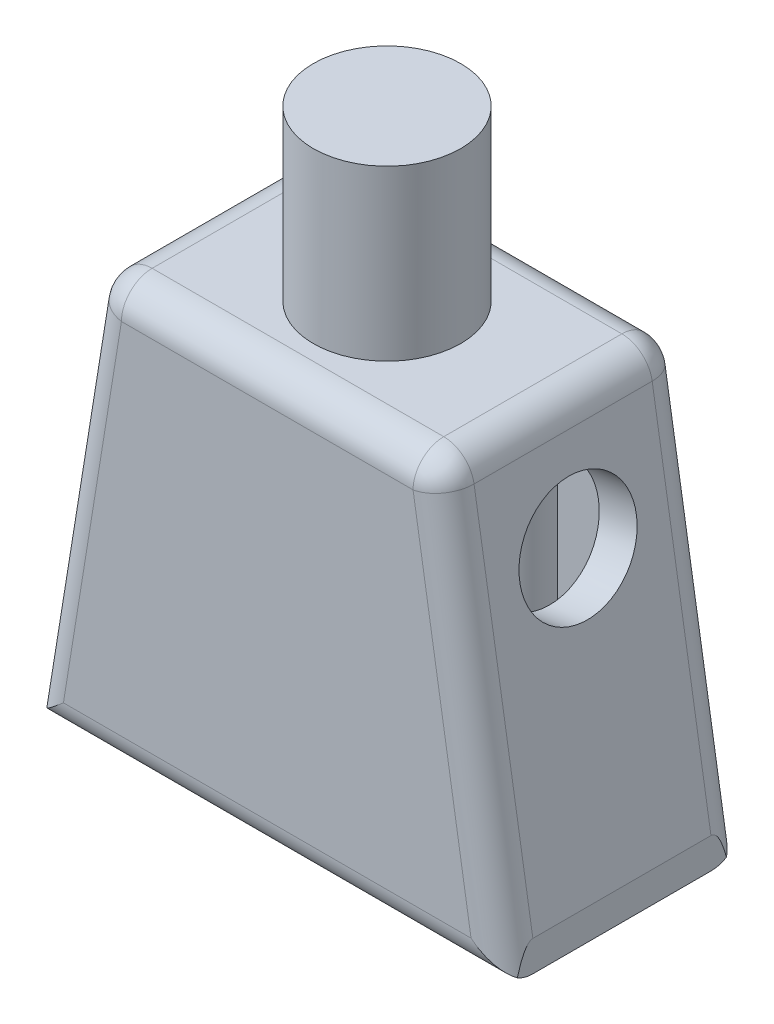
from build123d import *

# Parameters (mm, degrees)
BOSS_EXTRUDE1_DEPTH  = 3.9
SHELL2_T             = -1.25
SKETCH5_R            = 1.9
CUT_EXTRUDE2_DEPTH   = 7.8
FILLET1_R            = 1
SKETCH6_R            = 2.4
BOSS_EXTRUDE2_DEPTH  = 5.5
SKETCH7_R            = 1.25
CUT_EXTRUDE3_DEPTH   = 4.25
BOSS_EXTRUDE3_DEPTH  = 12.449209595
MIRROR3_COPY_1_DEPTH = 12.449209595


with BuildPart() as part:
    # Sketch4 → Boss-Extrude1 (new, symmetric)
    with BuildSketch(Plane.XY):
        Polygon((7.65, 0), (-7.65, 0), (-7.65, 1), (-5.6, 13.699209595), (5.6, 13.699209595), (7.65, 1), align=None)
    extrude(amount=BOSS_EXTRUDE1_DEPTH, both=True)

    # Shell2
    shell2_openings = [part.faces().sort_by_distance(p)[0] for p in [
        (0, 0, 0),
    ]]
    offset(amount=SHELL2_T, openings=shell2_openings, kind=Kind.INTERSECTION)

    # Sketch5 → Cut-Extrude2 (cut)
    with BuildSketch(Plane(origin=(7.613040698, 1.228953134, 0), x_dir=(0, 0, -1), z_dir=(0.9872198433487761, 0.15936430245954739, 0))):
        with Locations(Location((0, 8.728225826, 0), (0, 0, 90))):
            Circle(SKETCH5_R)
    cut_extrude2 = extrude(amount=-CUT_EXTRUDE2_DEPTH, mode=Mode.SUBTRACT)

    # Mirror1: Cut-Extrude2 across plane
    add(cut_extrude2.mirror(Plane(origin=(0, 0, 0), x_dir=(0, 0, 1), z_dir=(1, 0, 0))), mode=Mode.SUBTRACT)

    # Fillet1
    # the kernel refuses this fillet: 1 mm, written as the material it takes off along each edge
    with BuildSketch(Plane(origin=(4.748481766, 12.699209595, -2.9), x_dir=(0, 1, 0), z_dir=(0, 0, -1))) as fillet1_piece_1_section:
        Polygon((0, 0), (FILLET1_R, 0), (FILLET1_R, FILLET1_R * 0.851518233962), (FILLET1_R * 0.15936430246, FILLET1_R * 0.987219843349), align=None)
    fillet1_piece_1 = extrude(amount=FILLET1_R, mode=Mode.PRIVATE)
    fillet1_piece_1 = fillet1_piece_1 - Plane(origin=(4.748481766, 12.699209595, -2.9), x_dir=(-0.6483192491128319, -0.7613686040478513, 0), z_dir=(0, 0, -1)) * Sphere(FILLET1_R, mode=Mode.PRIVATE)
    add(fillet1_piece_1, mode=Mode.SUBTRACT)
    with BuildSketch(Plane(origin=(4.748481766, 12.699209595, 2.9), x_dir=(0, 1, 0), z_dir=(0, 0, 1))) as fillet1_piece_2_section:
        Polygon((0, 0), (FILLET1_R, 0), (FILLET1_R, -FILLET1_R * 0.851518233962), (FILLET1_R * 0.15936430246, -FILLET1_R * 0.987219843349), align=None)
    fillet1_piece_2 = extrude(amount=FILLET1_R, mode=Mode.PRIVATE)
    fillet1_piece_2 = fillet1_piece_2 - Plane(origin=(4.748481766, 12.699209595, 2.9), x_dir=(-0.6483192491128319, -0.7613686040478513, 0), z_dir=(0, 0, 1)) * Sphere(FILLET1_R, mode=Mode.PRIVATE)
    add(fillet1_piece_2, mode=Mode.SUBTRACT)
    with BuildSketch(Plane(origin=(-4.748481766, 12.699209595, 2.9), x_dir=(-0.9872198433487762, 0.15936430245954666, 0), z_dir=(0, 0, 1))) as fillet1_piece_3_section:
        Polygon((0, 0), (FILLET1_R, 0), (FILLET1_R, -FILLET1_R * 0.851518233962), (FILLET1_R * 0.15936430246, -FILLET1_R * 0.987219843349), align=None)
    fillet1_piece_3 = extrude(amount=FILLET1_R, mode=Mode.PRIVATE)
    fillet1_piece_3 = fillet1_piece_3 - Plane(origin=(-4.748481766, 12.699209595, 2.9), x_dir=(0.6483192491128325, -0.7613686040478509, 0), z_dir=(0, 0, 1)) * Sphere(FILLET1_R, mode=Mode.PRIVATE)
    add(fillet1_piece_3, mode=Mode.SUBTRACT)
    with BuildSketch(Plane(origin=(-4.748481766, 12.699209595, -2.9), x_dir=(-0.9872198433487762, 0.15936430245954666, 0), z_dir=(0, 0, -1))) as fillet1_piece_4_section:
        Polygon((0, 0), (FILLET1_R, 0), (FILLET1_R, FILLET1_R * 0.851518233962), (FILLET1_R * 0.15936430246, FILLET1_R * 0.987219843349), align=None)
    fillet1_piece_4 = extrude(amount=FILLET1_R, mode=Mode.PRIVATE)
    fillet1_piece_4 = fillet1_piece_4 - Plane(origin=(-4.748481766, 12.699209595, -2.9), x_dir=(0.6483192491128325, -0.7613686040478509, 0), z_dir=(0, 0, -1)) * Sphere(FILLET1_R, mode=Mode.PRIVATE)
    add(fillet1_piece_4, mode=Mode.SUBTRACT)
    with BuildSketch(Plane(origin=(5.6, 13.699209595, -2.9), x_dir=(-1, 0, 0), z_dir=(0, 0, 1))) as fillet1_piece_5:
        with BuildLine():
            CenterArc((FILLET1_R * 0.851518233962, FILLET1_R), FILLET1_R, 189.17, 80.83)
            Line((-FILLET1_R * 0.135701609387, FILLET1_R * 0.84063569754), (0, 0))
            Line((0, 0), (FILLET1_R * 0.851518233962, 0))
        make_face()
    extrude(amount=5.8, mode=Mode.SUBTRACT)
    with BuildSketch(Plane(origin=(-4.748481766, 13.699209595, 3.9), x_dir=(0, -1, 0), z_dir=(1, 0, 0)), Plane(origin=(-4.748481766, 13.699209595, -3.9), x_dir=(0, 0, 1), z_dir=(1, 0, 0))) as fillet1_piece_6:
        with BuildLine():
            CenterArc((FILLET1_R, FILLET1_R), FILLET1_R, 180, 90)
            Line((0, FILLET1_R), (0, 0))
            Line((0, 0), (FILLET1_R, 0))
        make_face()
    extrude(amount=9.496963532, mode=Mode.SUBTRACT)
    with BuildSketch(Plane(origin=(-5.6, 13.699209595, 2.9), x_dir=(-0.15936430245954636, -0.9872198433487762, 0), z_dir=(0, 0, -1))) as fillet1_piece_7:
        with BuildLine():
            CenterArc((FILLET1_R * 0.851518233962, -FILLET1_R), FILLET1_R, 90, 80.83)
            Line((-FILLET1_R * 0.135701609387, -FILLET1_R * 0.84063569754), (0, 0))
            Line((0, 0), (FILLET1_R * 0.851518233962, 0))
        make_face()
    extrude(amount=5.8, mode=Mode.SUBTRACT)
    with BuildSketch(Plane(origin=(5.735701609, 12.858573897, 3.9), x_dir=(-0.9872198433487762, -0.15936430245954736, 0), z_dir=(0.15936430245954736, -0.9872198433487761, 0)), Plane(origin=(5.735701609, 12.858573897, -3.9), x_dir=(0, 0, 1), z_dir=(0.15936430245954736, -0.9872198433487761, 0)), Plane(origin=(-8.048410756, -1.468049608, -3.9), x_dir=(0, 0, 1), z_dir=(0.15936430245954666, 0.9872198433487762, 0)), Plane(origin=(-8.048410756, -1.468049608, 3.9), x_dir=(0.9872198433487762, -0.15936430245954664, 0), z_dir=(0.15936430245954666, 0.9872198433487762, 0))) as fillet1_piece_8:
        with BuildLine():
            CenterArc((FILLET1_R, FILLET1_R), FILLET1_R, 180, 90)
            Line((0, FILLET1_R), (0, 0))
            Line((0, 0), (FILLET1_R, 0))
        make_face()
    extrude(amount=14.512090293, mode=Mode.SUBTRACT)
    with BuildSketch(Plane(origin=(10.15, 0, 3.9), x_dir=(0, 1, 0), z_dir=(-1, 0, 0)), Plane(origin=(10.15, 0, -3.9), x_dir=(0, 0, 1), z_dir=(-1, 0, 0))) as fillet1_piece_9:
        with BuildLine():
            CenterArc((FILLET1_R, FILLET1_R), FILLET1_R, 180, 90)
            Line((0, FILLET1_R), (0, 0))
            Line((0, 0), (FILLET1_R, 0))
        make_face()
    extrude(amount=20.3, mode=Mode.SUBTRACT)

    # Sketch6 → Boss-Extrude2 (add)
    with BuildSketch(Plane(origin=(0, 13.699209595, 0), x_dir=(1, 0, 0), z_dir=(0, 1, 0))):
        Circle(SKETCH6_R)
    extrude(amount=BOSS_EXTRUDE2_DEPTH)

    # Sketch7 → Cut-Extrude3 (cut)
    with BuildSketch(Plane.XZ.offset(-12.449209595)):
        Circle(SKETCH7_R)
    extrude(amount=-CUT_EXTRUDE3_DEPTH, mode=Mode.SUBTRACT)

    # Sketch8 → Boss-Extrude3 (add)
    with BuildSketch(Plane.XZ):
        with BuildLine():
            Line((-1.5, -2.65), (-1.5, -1.25))
            ThreePointArc((-1.5, -1.25), (-2.489949494, -1.660050506), (-2.9, -2.65))
            Line((-2.9, -2.65), (-1.5, -2.65))
        make_face()
    boss_extrude3 = extrude(amount=-BOSS_EXTRUDE3_DEPTH)

    # Mirror2: Boss-Extrude3 across plane
    add(boss_extrude3.mirror(Plane(origin=(0, 0, 0), x_dir=(0, 0, 1), z_dir=(1, 0, 0))))

    # Mirror3: Boss-Extrude3 across plane
    add(boss_extrude3.mirror(Plane.XY))

    # Mirror3 copy 1 sketch → Mirror3 copy 1 (add)
    with BuildSketch(Plane(origin=(0, 0, 0), x_dir=(-1, 0, 0), z_dir=(0, -1, 0))):
        with BuildLine():
            Line((-1.5, -2.65), (-1.5, -1.25))
            ThreePointArc((-1.5, -1.25), (-2.489949494, -1.660050506), (-2.9, -2.65))
            Line((-2.9, -2.65), (-1.5, -2.65))
        make_face()
    extrude(amount=-MIRROR3_COPY_1_DEPTH)


solid = part.part
